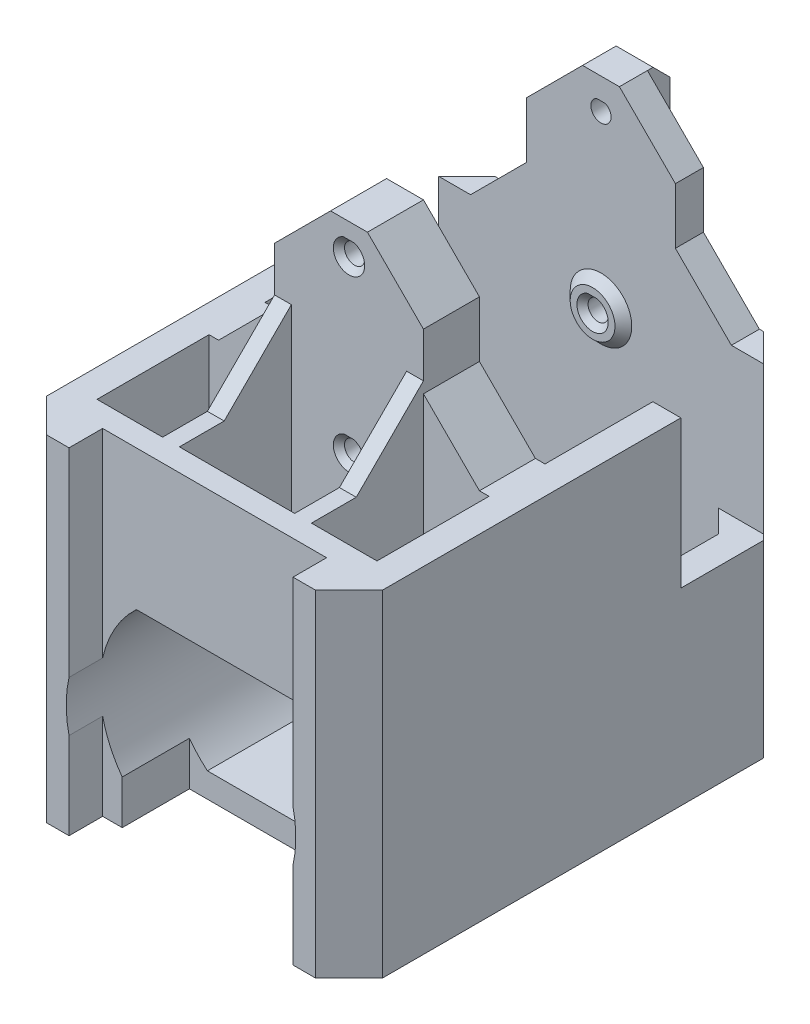
from build123d import *

# Parameters (mm, degrees)
SKETCH1_W            = 30
SKETCH1_H            = 40
BOSS_EXTRUDE1_DEPTH  = 40
CUT_EXTRUDE1_DEPTH   = 35
SKETCH4_W            = 25
SKETCH4_H            = 35
CUT_EXTRUDE3_DEPTH   = 20
SKETCH5_W            = 25
SKETCH5_H            = 17.5
CUT_EXTRUDE4_DEPTH   = 20
SKETCH13_W           = 25
SKETCH13_H           = 5
BOSS_EXTRUDE3_DEPTH  = 20
CUT_EXTRUDE5_DEPTH   = 40
CUT_EXTRUDE6_START   = -40
CUT_EXTRUDE6_DEPTH   = 40
CUT_EXTRUDE9_START   = -40
SKETCH10_W           = 30
SKETCH10_H           = 10
CUT_EXTRUDE9_DEPTH   = 40
CHAMFER2_SIZE        = 3
CUT_EXTRUDE10_DEPTH  = 28.5
SKETCH17_W           = 25
SKETCH17_H           = 2.5
BOSS_EXTRUDE4_DEPTH  = 10
CUT_EXTRUDE13_START  = -30
SKETCH18_W           = 20
SKETCH18_H           = 3
CUT_EXTRUDE13_DEPTH  = 30
SKETCH19_W           = 16.5
SKETCH19_H           = 6
CUT_EXTRUDE14_DEPTH  = 10
BOSS_EXTRUDE5_DEPTH  = 8.5
SKETCH22_W           = 25
SKETCH22_H           = 5
BOSS_EXTRUDE6_DEPTH  = 1
SKETCH23_W           = 13.292868742
SKETCH23_H           = 5
BOSS_EXTRUDE7_DEPTH  = 15
CHAMFER4_SIZE        = 5
CHAMFER6_SIZE        = 5
SKETCH30_W           = 1.5
SKETCH30_H           = 10
BOSS_EXTRUDE8_DEPTH  = 20
CHAMFER10_SIZE       = 14
CUT_EXTRUDE15_DEPTH  = 25
CHAMFER11_SIZE       = 2
BOSS_EXTRUDE9_START  = 0.75
SKETCH31_R           = 2
BOSS_EXTRUDE9_DEPTH  = 0.75
CHAMFER12_SIZE       = 0.5
CHAMFER13_SIZE       = 0.5
CHAMFER14_SIZE       = 0.75
CHAMFER15_SIZE       = 0.5
BOSS_EXTRUDE10_START = 2
SKETCH32_W           = 3.292868742
SKETCH32_H           = 5.46
BOSS_EXTRUDE10_DEPTH = 2
CHAMFER16_SIZE       = 3
CHAMFER17_SIZE       = 1.5


# Some blends are built 0.0001 mm under size
with BuildPart() as part:
    # Sketch1 → Boss-Extrude1 (new body)
    with BuildSketch(Plane.XY):
        Rectangle(SKETCH1_W, SKETCH1_H)
    extrude(amount=BOSS_EXTRUDE1_DEPTH)

    # Sketch2 → Cut-Extrude1 (cut)
    with BuildSketch(Plane.XY.offset(40)):
        with BuildLine():
            Line((-6.986594306, -2.5), (6.986594306, -2.5))
            ThreePointArc((6.986594306, -2.5), (10.247468698, -10.227783409), (6.646434371, -17.80303852))
            Line((6.646434371, -17.80303852), (-6.646434371, -17.80303852))
            ThreePointArc((-6.646434371, -17.80303852), (-10.247468698, -10.227783409), (-6.986594306, -2.5))
        make_face()
    extrude(amount=-CUT_EXTRUDE1_DEPTH, mode=Mode.SUBTRACT)

    # Sketch4 → Cut-Extrude3 (cut)
    with BuildSketch(Plane(origin=(0, 20, 0), x_dir=(1, 0, 0), z_dir=(0, 1, 0))):
        with Locations((0, -20)):
            Rectangle(SKETCH4_W, SKETCH4_H)
    extrude(amount=-CUT_EXTRUDE3_DEPTH, mode=Mode.SUBTRACT)

    # Sketch5 → Cut-Extrude4 (cut)
    with BuildSketch(Plane(origin=(0, 0, 0), x_dir=(1, 0, 0), z_dir=(0, 1, 0))):
        with Locations((0, -11.25)):
            Rectangle(SKETCH5_W, SKETCH5_H)
    extrude(amount=-CUT_EXTRUDE4_DEPTH, mode=Mode.SUBTRACT)

    # Sketch13 → Boss-Extrude3 (add)
    with BuildSketch(Plane(origin=(0, 0, 0), x_dir=(1, 0, 0), z_dir=(0, 1, 0))):
        with Locations((0, -22.5)):
            Rectangle(SKETCH13_W, SKETCH13_H)
    extrude(amount=BOSS_EXTRUDE3_DEPTH)

    # Sketch8 → Cut-Extrude5 (cut)
    with BuildSketch(Plane.XY.offset(40)):
        with BuildLine():
            Line((-0.546667462, -9.162650201), (0.546667462, -9.162650201))
            ThreePointArc((0.546667462, -9.162650201), (0, -11.425011068), (-0.546667462, -9.162650201))
        make_face()
    extrude(amount=-CUT_EXTRUDE5_DEPTH, mode=Mode.SUBTRACT)

    # Sketch9 → Cut-Extrude6 (cut)
    with BuildSketch(Plane(origin=(0, 0, 0), x_dir=(-1, 0, 0), z_dir=(0, 0, -1)).offset(CUT_EXTRUDE6_START)):
        with BuildLine():
            Line((-0.354264308, 7.849559809), (0.354264308, 7.849559809))
            ThreePointArc((0.354264308, 7.849559809), (0, 6.122216591), (-0.354264308, 7.849559809))
        make_face()
    extrude(amount=CUT_EXTRUDE6_DEPTH, mode=Mode.SUBTRACT)

    # Sketch10 → Cut-Extrude9 (cut)
    with BuildSketch(Plane.XY.offset(40).offset(CUT_EXTRUDE9_START)):
        with Locations((0, 15)):
            Rectangle(SKETCH10_W, SKETCH10_H)
    extrude(amount=CUT_EXTRUDE9_DEPTH, mode=Mode.SUBTRACT)

    # Chamfer2
    chamfer2_edges = [part.edges().sort_by_distance(p)[0] for p in [
        (-15, -5, 0),
        (-15, -5, 40),
        (15, -5, 40),
        (15, -5, 0),
    ]]
    chamfer(chamfer2_edges, length=CHAMFER2_SIZE)

    # Sketch16 → Cut-Extrude10 (cut, symmetric)
    with BuildSketch(Plane(origin=(-12.5, 0, 0), x_dir=(0, 0, -1), z_dir=(1, 0, 0))):
        Polygon((-2.5, 10), (-9.536752506, 10), (-10.366434052, 10), (-10.366434052, -3.164876481), (-9.536752506, -3.164876481), (-2.5, -3.164876481), align=None)
    extrude(amount=CUT_EXTRUDE10_DEPTH, both=True, mode=Mode.SUBTRACT)

    # Sketch17 → Boss-Extrude4 (add)
    with BuildSketch(Plane(origin=(0, 10, 0), x_dir=(1, 0, 0), z_dir=(0, 1, 0))):
        with Locations((0, -36.25)):
            Rectangle(SKETCH17_W, SKETCH17_H)
    extrude(amount=-BOSS_EXTRUDE4_DEPTH)

    # Sketch18 → Cut-Extrude13 (cut)
    with BuildSketch(Plane(origin=(0, 10, 0), x_dir=(1, 0, 0), z_dir=(0, 1, 0)).offset(CUT_EXTRUDE13_START)):
        with Locations((0, -38.5)):
            Rectangle(SKETCH18_W, SKETCH18_H)
    extrude(amount=CUT_EXTRUDE13_DEPTH, mode=Mode.SUBTRACT)

    # Sketch19 → Cut-Extrude14 (cut)
    with BuildSketch(Plane.XZ.offset(20)):
        with Locations((0, 34)):
            Rectangle(SKETCH19_W, SKETCH19_H)
    extrude(amount=-CUT_EXTRUDE14_DEPTH, mode=Mode.SUBTRACT)

    # Sketch20 → Boss-Extrude5 (add)
    with BuildSketch(Plane(origin=(0, 0, 20), x_dir=(-1, 0, 0), z_dir=(0, 0, -1))):
        with BuildLine():
            Line((12.5, -10), (10.25, -10))
            ThreePointArc((10.25, -10), (9.305601869, -14.297472961), (6.646434371, -17.80303852))
            Line((6.646434371, -17.80303852), (-6.646434371, -17.80303852))
            ThreePointArc((-6.646434371, -17.80303852), (-9.305601869, -14.297472961), (-10.25, -10))
            Line((-10.25, -10), (-12.5, -10))
            Line((-12.5, -10), (-12.5, -20))
            Line((-12.5, -20), (12.5, -20))
            Line((12.5, -20), (12.5, -10))
        make_face()
    extrude(amount=BOSS_EXTRUDE5_DEPTH)

    # Sketch22 → Boss-Extrude6 (add)
    with BuildSketch(Plane(origin=(0, 0, 11.5), x_dir=(-1, 0, 0), z_dir=(0, 0, -1))):
        with Locations((0, -17.5)):
            Rectangle(SKETCH22_W, SKETCH22_H)
    extrude(amount=BOSS_EXTRUDE6_DEPTH)

    # Sketch23 → Boss-Extrude7 (add)
    with BuildSketch(Plane(origin=(0, 10, 0), x_dir=(1, 0, 0), z_dir=(0, 1, 0))):
        with Locations((0, -22.5)):
            Rectangle(SKETCH23_W, SKETCH23_H)
        Polygon((6.646434371, 0), (6.646434371, -2.5), (0, -2.5), (-6.646434371, -2.5), (-6.646434371, 0), align=None)
    extrude(amount=BOSS_EXTRUDE7_DEPTH)

    # Chamfer4
    chamfer4_edges = [part.edges().sort_by_distance(p)[0] for p in [
        (6.646434371, 10, 22.5),
        (-6.646434371, 10, 22.5),
        (6.646434371, 10, 1.25),
        (-6.646434371, 10, 1.25),
    ]]
    chamfer(chamfer4_edges, length=CHAMFER4_SIZE)

    # Chamfer6
    chamfer6_edges = [part.edges().sort_by_distance(p)[0] for p in [
        (6.646434371, 25, 22.5),
        (-6.646434371, 25, 22.5),
        (6.646434371, 25, 1.25),
        (-6.646434371, 25, 1.25),
    ]]
    chamfer(chamfer6_edges, length=CHAMFER6_SIZE)

    # Sketch30 → Boss-Extrude8 (add)
    with BuildSketch(Plane(origin=(0, 0, 0), x_dir=(1, 0, 0), z_dir=(0, 1, 0))):
        with Locations((-5.896434371, -30)):
            Rectangle(SKETCH30_W, SKETCH30_H)
        with Locations((5.896434371, -30)):
            Rectangle(SKETCH30_W, SKETCH30_H)
    extrude(amount=BOSS_EXTRUDE8_DEPTH)

    # Chamfer10
    # the kernel refuses this chamfer: 14 mm, written as the material it takes off along each edge
    with BuildSketch(Plane(origin=(-30.85712746, 20, 35), x_dir=(0, -0.9996219169112968, 0.02749587661058661), z_dir=(1, 0, 0))) as chamfer10_piece_1_section:
        Polygon((CHAMFER10_SIZE * 0.999621916911, CHAMFER10_SIZE * 0.0274958766106), (-CHAMFER10_SIZE * 0.0274958766106, CHAMFER10_SIZE * 0.999621916911), (0, 0), align=None)
    chamfer10_piece_1 = extrude(amount=73.507123663, mode=Mode.PRIVATE)
    chamfer10_piece_1 = split(chamfer10_piece_1, bisect_by=Plane(origin=(5.896434371, 10, 30.768271906), z_dir=(0, 1, 0)), keep=Keep.TOP, mode=Mode.PRIVATE)
    chamfer10_piece_1 = split(chamfer10_piece_1, bisect_by=Plane(origin=(5.896434371, 15.768271906, 25), z_dir=(0, 0, 1)), keep=Keep.TOP, mode=Mode.PRIVATE)
    add(chamfer10_piece_1, mode=Mode.SUBTRACT)
    with BuildSketch(Plane(origin=(30.85712746, 20, 35), x_dir=(0, -0.9996219169112968, 0.02749587661058661), z_dir=(-1, 0, 0))) as chamfer10_piece_2_section:
        Polygon((CHAMFER10_SIZE * 0.999621916911, -CHAMFER10_SIZE * 0.0274958766106), (-CHAMFER10_SIZE * 0.0274958766106, -CHAMFER10_SIZE * 0.999621916911), (0, 0), align=None)
    chamfer10_piece_2 = extrude(amount=73.507123663, mode=Mode.PRIVATE)
    chamfer10_piece_2 = split(chamfer10_piece_2, bisect_by=Plane(origin=(-5.896434371, 10, 30.768271906), z_dir=(0, 1, 0)), keep=Keep.TOP, mode=Mode.PRIVATE)
    chamfer10_piece_2 = split(chamfer10_piece_2, bisect_by=Plane(origin=(-5.896434371, 15.768271906, 25), z_dir=(0, 0, 1)), keep=Keep.TOP, mode=Mode.PRIVATE)
    add(chamfer10_piece_2, mode=Mode.SUBTRACT)

    # Sketch29 → Cut-Extrude15 (cut)
    with BuildSketch(Plane(origin=(0, 0, 0), x_dir=(-1, 0, 0), z_dir=(0, 0, -1))):
        with BuildLine():
            Line((-0.403434811, 23.074512494), (0.403434811, 23.074512494))
            ThreePointArc((0.403434811, 23.074512494), (0, 21.37), (-0.403434811, 23.074512494))
        make_face()
    extrude(amount=-CUT_EXTRUDE15_DEPTH, mode=Mode.SUBTRACT)

    # Chamfer11
    chamfer11_edges = [part.edges().sort_by_distance(p)[0] for p in [
        (12.5, -11.58243824, 2.5),
        (-12.5, -11.58243824, 2.5),
    ]]
    chamfer(chamfer11_edges, length=CHAMFER11_SIZE)

    # Sketch31 → Boss-Extrude9 (add)
    with BuildSketch(Plane.XY.offset(2.5).offset(BOSS_EXTRUDE9_START)):
        with Locations(Location((0, 7.022216591, 0), (0, 0, 180))):
            Circle(SKETCH31_R)
        with BuildLine():
            Line((-0.354264308, 7.849559809), (0.354264308, 7.849559809))
            ThreePointArc((0.354264308, 7.849559809), (0, 6.122216591), (-0.354264308, 7.849559809))
        make_face(mode=Mode.SUBTRACT)
    extrude(amount=-BOSS_EXTRUDE9_DEPTH)

    # Chamfer12
    chamfer12_edges = [part.edges().sort_by_distance(p)[0] for p in [
        (0, 6.122216591, 3.25),
    ]]
    chamfer(chamfer12_edges, length=CHAMFER12_SIZE)

    # Chamfer13
    chamfer13_edges = [part.edges().sort_by_distance(p)[0] for p in [
        (0, 7.849559809, 3.25),
    ]]
    chamfer(chamfer13_edges, length=CHAMFER13_SIZE)

    # Chamfer14
    chamfer14_edges = [part.edges().sort_by_distance(p)[0] for p in [
        (2, 7.022216591, 2.5),
    ]]
    chamfer(chamfer14_edges, length=CHAMFER14_SIZE - 0.0001)  # a hair under: the kernel refuses the full size

    # Chamfer15
    chamfer15_edges = [part.edges().sort_by_distance(p)[0] for p in [
        (0, 21.37, 25),
        (0, 23.074512494, 25),
        (0, 7.849559809, 25),
        (0, 6.122216591, 25),
    ]]
    chamfer(chamfer15_edges, length=CHAMFER15_SIZE)

    # Sketch32 → Boss-Extrude10 (add)
    with BuildSketch(Plane(origin=(0, 0, 0), x_dir=(-1, 0, 0), z_dir=(0, 0, -1)).offset(BOSS_EXTRUDE10_START)):
        with Locations((0, 22.27)):
            Rectangle(SKETCH32_W, SKETCH32_H)
        with BuildLine():
            Line((0.403434811, 23.074512494), (-0.403434811, 23.074512494))
            ThreePointArc((-0.403434811, 23.074512494), (0, 21.37), (0.403434811, 23.074512494))
        make_face(mode=Mode.SUBTRACT)
    extrude(amount=-BOSS_EXTRUDE10_DEPTH)

    # Chamfer16
    # the kernel refuses this chamfer: 3 mm, written as the material it adds along each edge
    with BuildSketch(Plane(origin=(1.646434371, 19.54, 0), x_dir=(0, -0.9996219169112968, 0.02749587661058636), z_dir=(-1, 0, 0))) as chamfer16_piece_1_section:
        Polygon((CHAMFER16_SIZE * 0.999621916911, -CHAMFER16_SIZE * 0.0274958766106), (-CHAMFER16_SIZE * 0.0274958766106, -CHAMFER16_SIZE * 0.999621916911), (0, 0), align=None)
    chamfer16_piece_1 = extrude(amount=3.292868742, mode=Mode.PRIVATE)
    chamfer16_piece_1 = split(chamfer16_piece_1, bisect_by=Plane(origin=(0, 18.447908995, -2), z_dir=(0, 0, 1)), keep=Keep.TOP, mode=Mode.PRIVATE)
    add(chamfer16_piece_1)

    # Chamfer17
    chamfer17_edges = [part.edges().sort_by_distance(p)[0] for p in [
        (0, 25, -2),
    ]]
    chamfer(chamfer17_edges, length=CHAMFER17_SIZE)


solid = part.part
